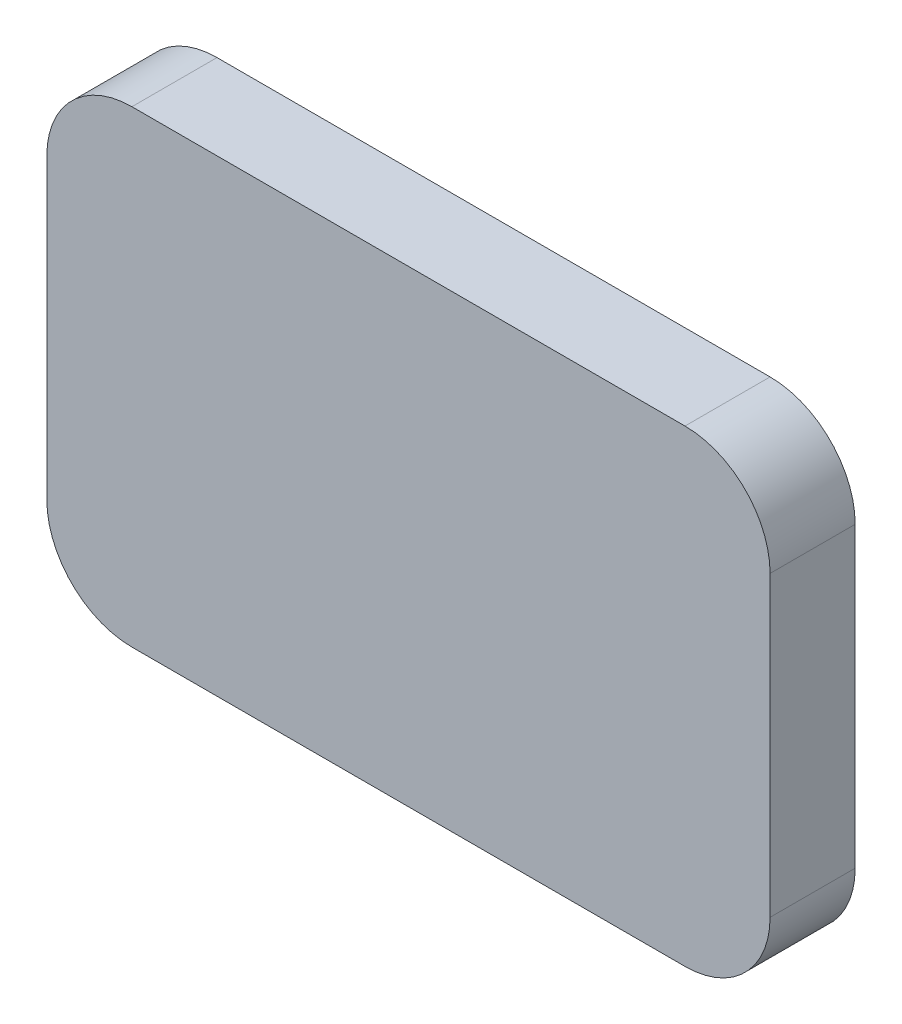
from build123d import *

# Parameters (mm, degrees)
BOSS_EXTRUDE2_DEPTH = 2
FILLET1_R           = 2


with BuildPart() as part:
    # Sketch1 → Boss-Extrude2 (new body)
    with BuildSketch(Plane.XY):
        Polygon((0, 11), (0, 0), (17, 0), (17, 4.9872583), (17, 7.25), (17, 11), align=None)
    extrude(amount=BOSS_EXTRUDE2_DEPTH)

    # Fillet1
    fillet1_edges = [part.edges().sort_by_distance(p)[0] for p in [
        (0, 0, 1),
        (17, 0, 1),
        (17, 11, 1),
        (0, 11, 1),
    ]]
    fillet(fillet1_edges, radius=FILLET1_R)


solid = part.part
